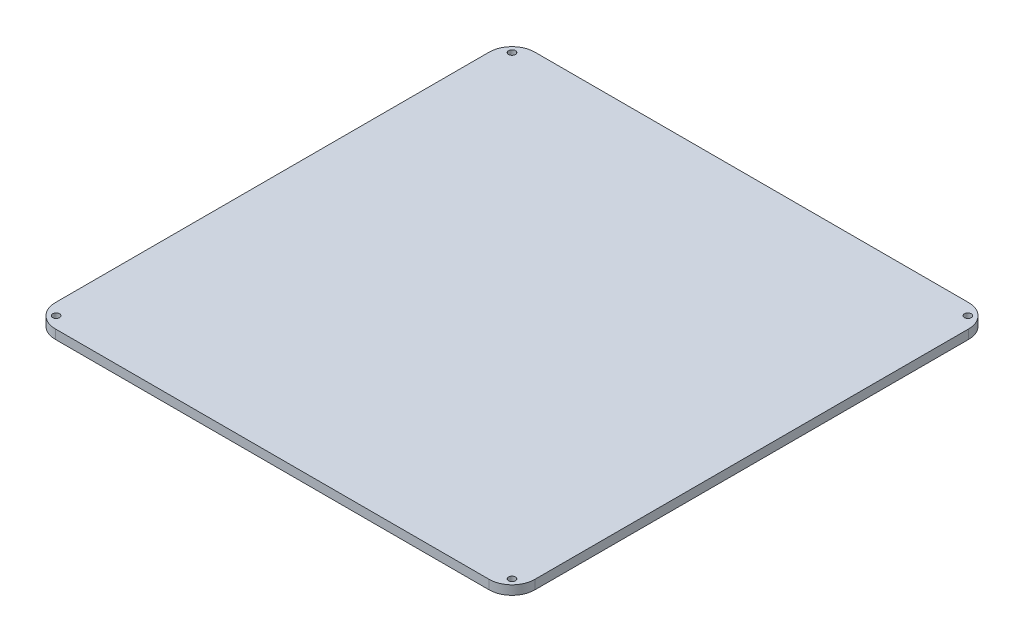
from build123d import *

# Parameters (mm, degrees)
SKETCH1_W         = 210
SKETCH1_H         = 210
MAINEXTRUDE_DEPTH = 4
SKETCH1_6_R       = 1.5
SCREWHOLES_DEPTH  = 4
ROUNDEDCORNERS_R  = 10
SKETCH2_R         = 2
SKETCH2_R_2       = 0.98
PCBHOLES_DEPTH    = 2
PCBROUNDS_R       = 2


with BuildPart() as part:
    # Sketch1 → MainExtrude (new body)
    with BuildSketch(Plane(origin=(0, 0, 0), x_dir=(1, 0, 0), z_dir=(0, 1, 0))):
        Rectangle(SKETCH1_W, SKETCH1_H)
    extrude(amount=MAINEXTRUDE_DEPTH)

    # Sketch1<6> → ScrewHoles (cut)
    with BuildSketch(Plane(origin=(0, 0, 0), x_dir=(1, 0, 0), z_dir=(0, 1, 0))):
        with Locations(Location((-99.833273811, 99.833273811, 0), (0, 0, 270))):
            Circle(SKETCH1_6_R)
        with Locations(Location((-99.833273811, -99.833273811, 0), (0, 0, 90))):
            Circle(SKETCH1_6_R)
        with Locations(Location((99.833273811, -99.833273811, 0), (0, 0, 270))):
            Circle(SKETCH1_6_R)
        with Locations(Location((99.833273811, 99.833273811, 0), (0, 0, 90))):
            Circle(SKETCH1_6_R)
    extrude(amount=SCREWHOLES_DEPTH, mode=Mode.SUBTRACT)

    # RoundedCorners
    roundedcorners_edges = [part.edges().sort_by_distance(p)[0] for p in [
        (-105, 2, -105),
        (-105, 2, 105),
        (105, 2, 105),
        (105, 2, -105),
    ]]
    fillet(roundedcorners_edges, radius=ROUNDEDCORNERS_R)

    # Sketch2 → PCBHoles (add)
    # profile 1 of 4: a face of its own
    with BuildSketch(Plane.XZ):
        with Locations(Location((-17.92, 37.135, 0), (0, 0, 90))):
            Circle(SKETCH2_R)
        with Locations(Location((-17.92, 37.135, 0), (0, 0, 270))):
            Circle(SKETCH2_R_2, mode=Mode.SUBTRACT)
    # profile 2 of 4: a face of its own
    with BuildSketch(Plane.XZ):
        with Locations(Location((17.92, 37.135, 0), (0, 0, 90))):
            Circle(SKETCH2_R)
        with Locations(Location((17.92, 37.135, 0), (0, 0, 270))):
            Circle(SKETCH2_R_2, mode=Mode.SUBTRACT)
    # profile 3 of 4: a face of its own
    with BuildSketch(Plane.XZ):
        with Locations(Location((-17.92, -37.135, 0), (0, 0, 90))):
            Circle(SKETCH2_R)
        with Locations(Location((-17.92, -37.135, 0), (0, 0, 90))):
            Circle(SKETCH2_R_2, mode=Mode.SUBTRACT)
    # profile 4 of 4: a face of its own
    with BuildSketch(Plane.XZ):
        with Locations(Location((17.92, -37.135, 0), (0, 0, 90))):
            Circle(SKETCH2_R)
        with Locations(Location((17.92, -37.135, 0), (0, 0, 90))):
            Circle(SKETCH2_R_2, mode=Mode.SUBTRACT)
    extrude(amount=PCBHOLES_DEPTH)

    # PCBRounds
    pcbrounds_edges = [part.edges().sort_by_distance(p)[0] for p in [
        (-17.92, 0, -39.135),
        (17.92, 0, -39.135),
        (-17.92, 0, 35.135),
        (17.92, 0, 35.135),
    ]]
    fillet(pcbrounds_edges, radius=PCBROUNDS_R - 0.0001)  # a hair under: the kernel refuses the full size


solid = part.part
